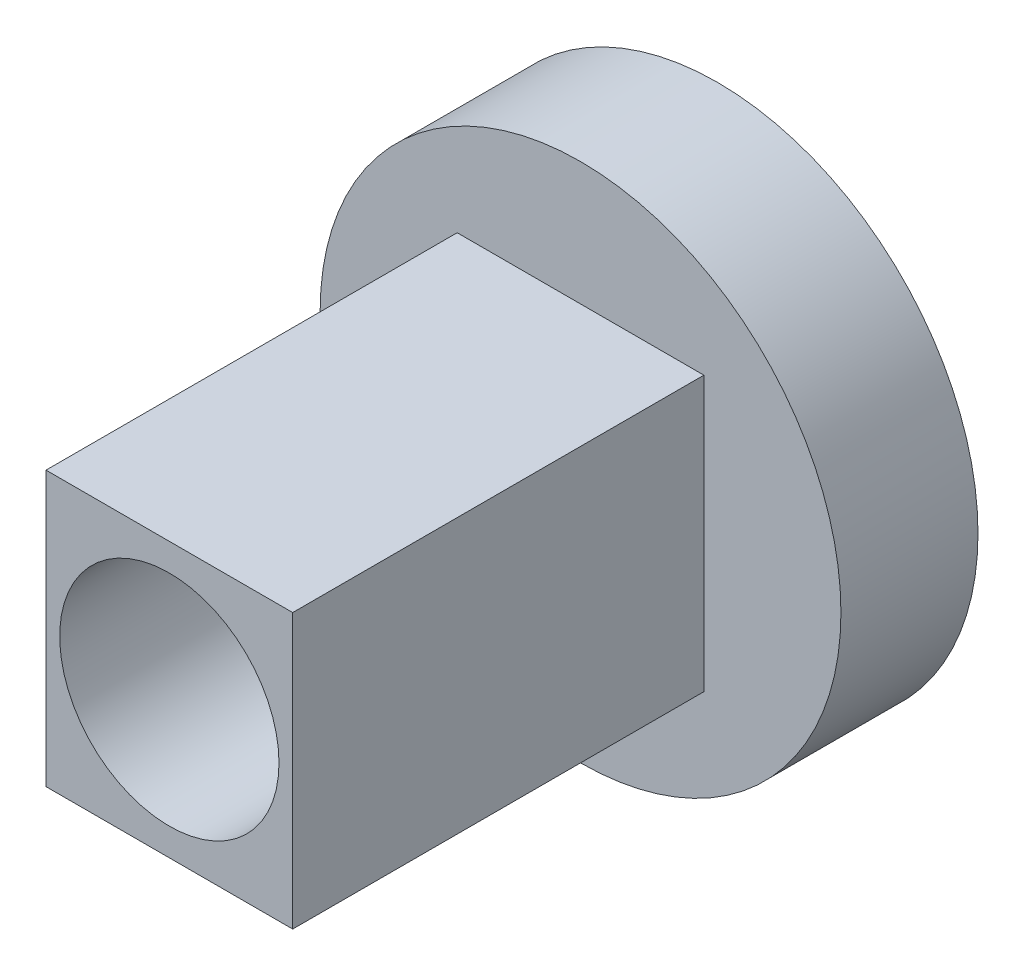
from build123d import *

# Parameters (mm, degrees)
SKETCH_1_R          = 95
EXTRUDE_1_DEPTH     = 50
SKETCH_2_W          = 90
SKETCH_2_H          = 100
EXTRUDE_2_DEPTH     = 150
SKETCH_3_R          = 40
CUT_EXTRUDE_1_DEPTH = 241.935676063
SHELL_1_OUTLINE_R   = 92
SHELL_1_OUTLINE_R_2 = 43
SHELL_1_DEPTH       = 47
SHELL_START         = 47
SHELL_1_2_DEPTH     = 150


# Read off the part's stored shape, not the designer's step: Оболочка1
with BuildPart() as part:
    # Эскиз1 → Бобышка-Вытянуть1 (new body)
    with BuildSketch(Plane.XY):
        Circle(SKETCH_1_R)
    extrude(amount=EXTRUDE_1_DEPTH)

    # Эскиз2 → Бобышка-Вытянуть2 (add)
    with BuildSketch(Plane.XY.offset(50)):
        Rectangle(SKETCH_2_W, SKETCH_2_H)
    extrude(amount=EXTRUDE_2_DEPTH)

    # Эскиз3 → Вырез-Вытянуть1 (cut, through all)
    with BuildSketch(Plane.XY.offset(200)):
        Circle(SKETCH_3_R)
    extrude(amount=-CUT_EXTRUDE_1_DEPTH, mode=Mode.SUBTRACT)

    # Оболочка1 outline → Оболочка1 (cut)
    with BuildSketch(Plane.XY):
        Circle(SHELL_1_OUTLINE_R)
        Circle(SHELL_1_OUTLINE_R_2, mode=Mode.SUBTRACT)
    extrude(amount=SHELL_1_DEPTH, mode=Mode.SUBTRACT)

    # Shell 1 2 outline → Shell 1 2 (cut)
    with BuildSketch(Plane.XY.offset(SHELL_START)):
        with BuildLine():
            ThreePointArc((-42, 9.219544457), (0, 43), (42, 9.219544457))
            Line((42, 9.219544457), (42, 47))
            Line((42, 47), (-42, 47))
            Line((-42, 47), (-42, 9.219544457))
        make_face()
        with BuildLine():
            Line((42, -47), (42, -9.219544457))
            ThreePointArc((42, -9.219544457), (0, -43), (-42, -9.219544457))
            Line((-42, -9.219544457), (-42, -47))
            Line((-42, -47), (42, -47))
        make_face()
    extrude(amount=SHELL_1_2_DEPTH, mode=Mode.SUBTRACT)


solid = part.part
